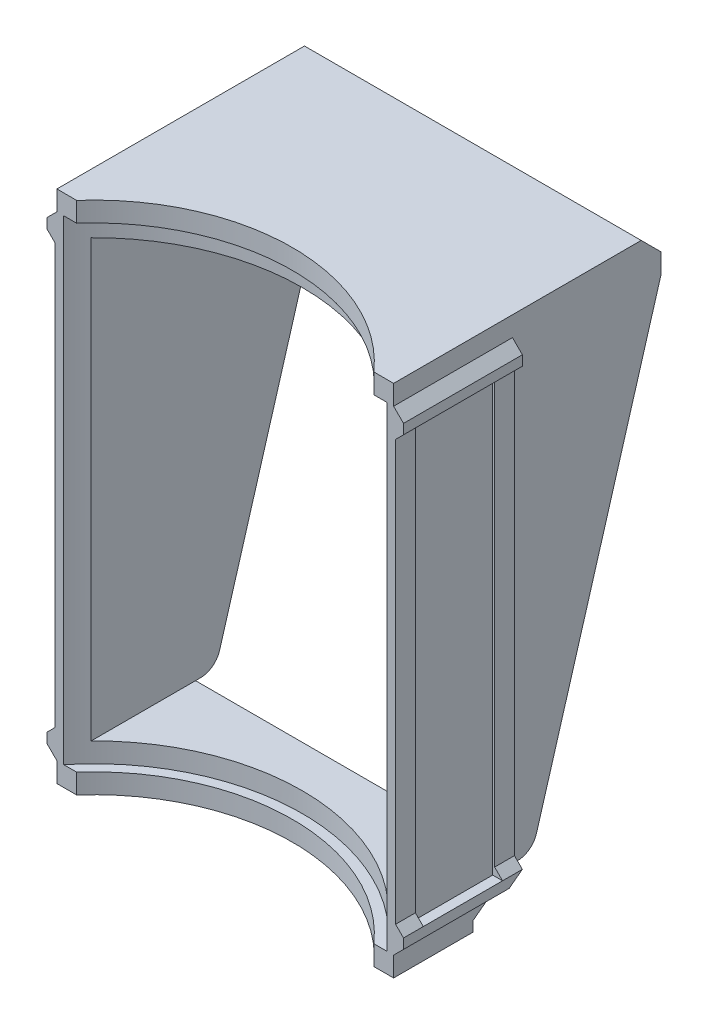
from build123d import *

# Parameters (mm, degrees)
BOSS_EXTRUDE1_DEPTH  = 100
BOSS_EXTRUDE2_DEPTH  = 100
CUT_EXTRUDE1_DEPTH   = 1101
BOSS_EXTRUDE3_DEPTH  = 2200
SKETCH6_W            = 10
SKETCH6_H            = 100
BOSS_EXTRUDE4_DEPTH  = 2200
SKETCH7_W            = 100
SKETCH7_H            = 2200
BOSS_EXTRUDE6_DEPTH  = 100
CHAMFER2_SIZE        = 40
MIRROR2_START        = -1261.437827766
MIRROR2_DEPTH        = 211.43967231
MIRROR2_START_2      = -1049.998155456
MIRROR2_2_DEPTH      = 388.56032769
MIRROR2_START_3      = 2400
MIRROR2_3_DEPTH      = 100
CHAMFER3_SIZE        = 40
BOSS_EXTRUDE7_DEPTH  = 100
BOSS_EXTRUDE8_DEPTH  = 100
FILLET2_R            = 100
BOSS_EXTRUDE9_DEPTH  = 100
SKETCH13_W           = 1700
SKETCH13_H           = 750
BOSS_EXTRUDE12_DEPTH = 200
CHAMFER5_SIZE        = 100
CUT_EXTRUDE2_DEPTH   = 3748.78362969


with BuildPart() as part:
    # Sketch1 → Boss-Extrude1 (new body)
    with BuildSketch(Plane(origin=(0, 0, 0), x_dir=(1, 0, 0), z_dir=(0, 1, 0))):
        with BuildLine():
            Line((-750, 661.437827766), (-850, 661.437827766))
            Line((-850, 661.437827766), (-850, 1261.437827766))
            Line((-850, 1261.437827766), (850, 1261.437827766))
            Line((850, 1261.437827766), (850, 661.437827766))
            Line((850, 661.437827766), (750, 661.437827766))
            ThreePointArc((750, 661.437827766), (0, 1000), (-750, 661.437827766))
        make_face()
    extrude(amount=BOSS_EXTRUDE1_DEPTH)

    # Sketch2 → Boss-Extrude2 (add)
    with BuildSketch(Plane(origin=(0, 100, 0), x_dir=(1, 0, 0), z_dir=(0, 1, 0))):
        with BuildLine():
            Line((850, 1261.437827766), (900, 1261.437827766))
            Line((900, 1261.437827766), (900, 661.437827766))
            Line((900, 661.437827766), (815.475321515, 661.437827766))
            ThreePointArc((815.475321515, 661.437827766), (0, 1050), (-815.475321515, 661.437827766))
            Line((-815.475321515, 661.437827766), (-850, 661.437827766))
            Line((-850, 661.437827766), (-900, 661.437827766))
            Line((-900, 661.437827766), (-900, 1261.437827766))
            Line((-900, 1261.437827766), (-850, 1261.437827766))
            Line((-850, 1261.437827766), (850, 1261.437827766))
        make_face()
    extrude(amount=BOSS_EXTRUDE2_DEPTH)

    # Sketch4 → Cut-Extrude1 (cut, through all)
    with BuildSketch(Plane.XY.offset(-661.437827766)):
        Polygon((-850, 100), (-900, 150), (-900, 100), align=None)
        Polygon((850, 100), (900, 150), (900, 100), align=None)
    extrude(amount=-CUT_EXTRUDE1_DEPTH, mode=Mode.SUBTRACT)

    # Sketch5 → Boss-Extrude3 (add)
    with BuildSketch(Plane(origin=(0, 200, 0), x_dir=(1, 0, 0), z_dir=(0, 1, 0))):
        with BuildLine():
            Line((-750, 1261.437827766), (-750, 734.846922835))
            ThreePointArc((-750, 734.846922835), (-783.597772698, 698.90952964), (-815.475321515, 661.437827766))
            Line((-815.475321515, 661.437827766), (-850, 661.437827766))
            Line((-850, 661.437827766), (-850, 1261.437827766))
            Line((-850, 1261.437827766), (-750, 1261.437827766))
        make_face()
        with BuildLine():
            Line((850, 661.437827766), (815.475321515, 661.437827766))
            ThreePointArc((815.475321515, 661.437827766), (783.597772698, 698.90952964), (750, 734.846922835))
            Line((750, 734.846922835), (750, 1261.437827766))
            Line((750, 1261.437827766), (850, 1261.437827766))
            Line((850, 1261.437827766), (850, 661.437827766))
        make_face()
    extrude(amount=BOSS_EXTRUDE3_DEPTH)

    # Sketch6 → Boss-Extrude4 (add)
    with BuildSketch(Plane(origin=(0, 200, 0), x_dir=(1, 0, 0), z_dir=(0, 1, 0))):
        with Locations((-855, 1211.437827766)):
            Rectangle(SKETCH6_W, SKETCH6_H)
        with Locations((-855, 711.437827766)):
            Rectangle(SKETCH6_W, SKETCH6_H)
    boss_extrude4 = extrude(amount=BOSS_EXTRUDE4_DEPTH)

    # Sketch7 → Boss-Extrude6 (add)
    with BuildSketch(Plane(origin=(0, 0, -1261.437827766), x_dir=(-1, 0, 0), z_dir=(0, 0, -1))):
        with Locations((-800, 1300)):
            Rectangle(SKETCH7_W, SKETCH7_H)
        with Locations((800, 1300)):
            Rectangle(SKETCH7_W, SKETCH7_H)
    extrude(amount=BOSS_EXTRUDE6_DEPTH)

    # Mirror1: Boss-Extrude4 across plane
    add(boss_extrude4.mirror(Plane(origin=(0, 0, 0), x_dir=(0, 0, 1), z_dir=(1, 0, 0))))

    # Chamfer2
    chamfer2_edges = [part.edges().sort_by_distance(p)[0] for p in [
        (-860, 200, -1211.437827766),
        (-860, 200, -711.437827766),
        (860, 200, -1211.437827766),
        (860, 200, -711.437827766),
    ]]
    chamfer(chamfer2_edges, length=CHAMFER2_SIZE - 0.0001)  # a hair under: the kernel refuses the full size

    # Mirror2: read off the stored shape, not the designer's step
    # Mirror2 outline → Mirror2 (add)
    with BuildSketch(Plane.XY.offset(MIRROR2_START)):
        Polygon((-850, 2500), (-900, 2450), (-900, 2400), (900, 2400), (900, 2450), (850, 2500), align=None)
    extrude(amount=MIRROR2_DEPTH)

    # Mirror2 2 outline → Mirror2 2 (add)
    with BuildSketch(Plane.XY.offset(MIRROR2_START_2)):
        Polygon((-850, 2500), (-900, 2450), (-900, 2400), (900, 2400), (900, 2450), (850, 2500), align=None)
    extrude(amount=MIRROR2_2_DEPTH)

    # Mirror2 3 outline → Mirror2 3 (cut)
    with BuildSketch(Plane(origin=(0, 0, 0), x_dir=(1, 0, 0), z_dir=(0, 1, 0)).offset(MIRROR2_START_3)):
        with BuildLine():
            ThreePointArc((815.475321515, 661.437827766), (0, 1050), (-815.475321515, 661.437827766))
            Line((-815.475321515, 661.437827766), (815.475321515, 661.437827766))
        make_face()
    extrude(amount=MIRROR2_3_DEPTH, mode=Mode.SUBTRACT)

    # Chamfer3
    chamfer3_edges = [part.edges().sort_by_distance(p)[0] for p in [
        (860, 2400, -1211.437827766),
        (860, 2400, -711.437827766),
        (-860, 2400, -711.437827766),
        (-860, 2400, -1211.437827766),
    ]]
    chamfer(chamfer3_edges, length=CHAMFER3_SIZE - 0.0001)  # a hair under: the kernel refuses the full size

    # Sketch9 → Boss-Extrude7 (add)
    with BuildSketch(Plane.ZY.offset(850)):
        Polygon((-1361.437827766, 200), (-2011.437827766, 2400), (-1361.437827766, 2400), align=None)
    extrude(amount=-BOSS_EXTRUDE7_DEPTH)

    # Sketch10 → Boss-Extrude8 (add)
    with BuildSketch(Plane.ZY.offset(-750)):
        Polygon((-2011.437827766, 2400), (-1361.437827766, 200), (-1361.437827766, 2400), align=None)
    extrude(amount=-BOSS_EXTRUDE8_DEPTH)

    # Fillet2
    fillet2_edges = [part.edges().sort_by_distance(p)[0] for p in [
        (-800, 200, -1361.437827766),
        (800, 200, -1361.437827766),
    ]]
    fillet(fillet2_edges, radius=FILLET2_R)

    # Sketch11 → Boss-Extrude9 (add)
    with BuildSketch(Plane(origin=(0, 2500, 0), x_dir=(1, 0, 0), z_dir=(0, 1, 0))):
        with BuildLine():
            Line((-850, 661.437827766), (-750, 661.437827766))
            ThreePointArc((-750, 661.437827766), (0, 1000), (750, 661.437827766))
            Line((750, 661.437827766), (850, 661.437827766))
            Line((850, 661.437827766), (850, 1261.437827766))
            Line((850, 1261.437827766), (-850, 1261.437827766))
            Line((-850, 1261.437827766), (-850, 661.437827766))
        make_face()
    extrude(amount=BOSS_EXTRUDE9_DEPTH)

    # Sketch13 → Boss-Extrude12 (add)
    with BuildSketch(Plane(origin=(0, 2400, 0), x_dir=(1, 0, 0), z_dir=(0, 1, 0))):
        with Locations((0, 1636.437827766)):
            Rectangle(SKETCH13_W, SKETCH13_H)
    extrude(amount=BOSS_EXTRUDE12_DEPTH)

    # Chamfer5
    chamfer5_edges = [part.edges().sort_by_distance(p)[0] for p in [
        (0, 2600, -2011.437827766),
    ]]
    chamfer(chamfer5_edges, length=CHAMFER5_SIZE)

    # Sketch14 → Cut-Extrude2 (cut, through all)
    with BuildSketch(Plane(origin=(900, 0, 0), x_dir=(0, 0, -1), z_dir=(1, 0, 0))):
        Polygon((1061.437827766, 50), (1261.437827766, 200), (1261.437827766, 50), (1261.437827766, 0), (1061.437827766, 0), align=None)
    extrude(amount=-CUT_EXTRUDE2_DEPTH, mode=Mode.SUBTRACT)


solid = part.part
